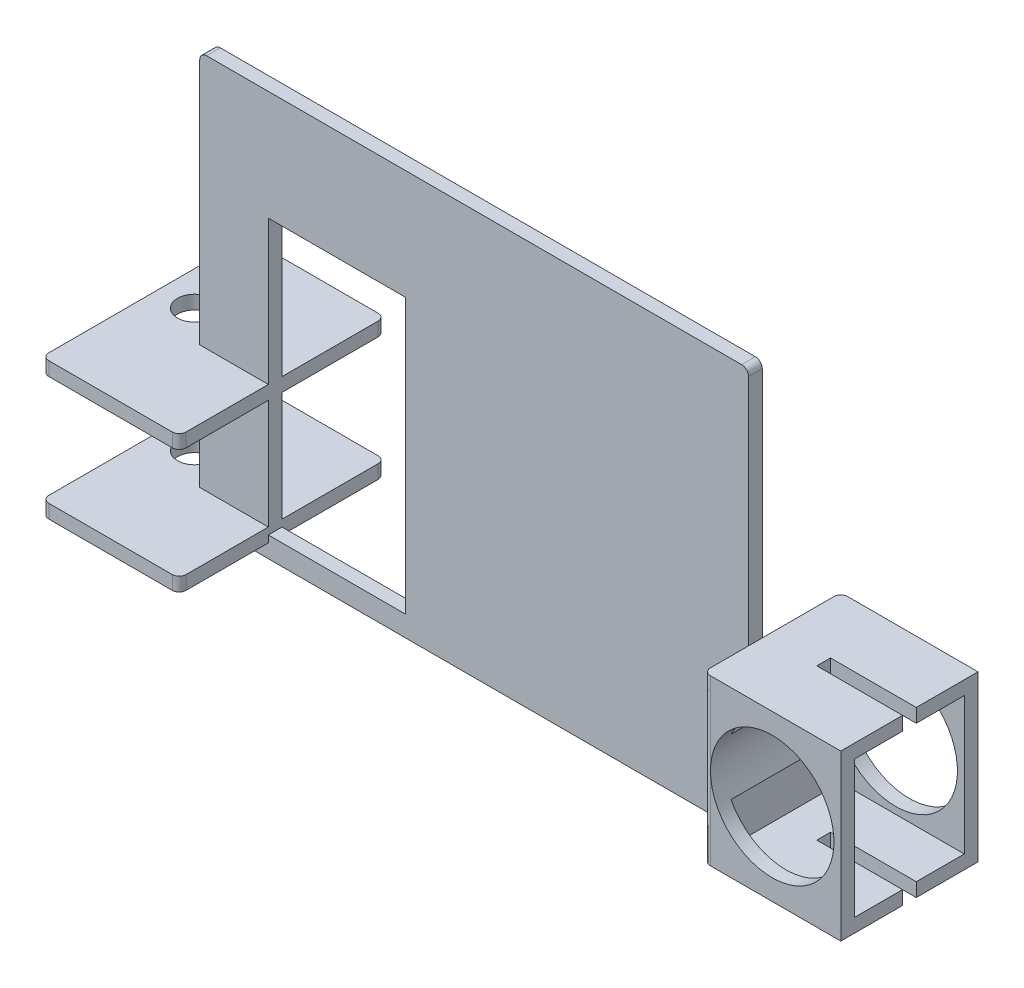
from build123d import *

# Parameters (mm, degrees)
BOSS_EXTRUDE1_DEPTH = 20
FILLET1_R           = 1
SKETCH2_R           = 9
CUT_EXTRUDE1_DEPTH  = 20
BOSS_EXTRUDE2_START = 2
BOSS_EXTRUDE2_DEPTH = 2
SKETCH4_W           = 20
SKETCH4_H           = 20
BOSS_EXTRUDE3_DEPTH = 2
FILLET2_R           = 1
SKETCH5_W           = 12.5
SKETCH5_H           = 2
CUT_EXTRUDE2_DEPTH  = 24
BOSS_EXTRUDE4_DEPTH = 80
FILLET3_R           = 1
SKETCH8_R           = 7.11392485
SKETCH8_W           = 20
SKETCH8_H           = 40
CUT_EXTRUDE3_DEPTH  = 2
SKETCH9_W           = 20
SKETCH9_H           = 2
BOSS_EXTRUDE5_DEPTH = 15
FILLET4_R           = 1
SKETCH10_R          = 2.5
CUT_EXTRUDE4_DEPTH  = 20
CUT_EXTRUDE5_DEPTH  = 1000
SKETCH12_W          = 38.052123651
SKETCH12_H          = 24.689337754
CUT_EXTRUDE6_DEPTH  = 200


with BuildPart() as part:
    # Sketch1 → Boss-Extrude1 (new body)
    with BuildSketch(Plane(origin=(0, 0, 0), x_dir=(1, 0, 0), z_dir=(0, 1, 0))):
        Polygon((-2.291666667, 11.041666667), (-22.291666667, 11.041666667), (-22.291666667, -8.958333333), (-2.291666667, -8.958333333), (-2.291666667, -6.958333333), (-20.291666667, -6.958333333), (-20.291666667, 9.041666667), (-2.291666667, 9.041666667), align=None)
    extrude(amount=BOSS_EXTRUDE1_DEPTH)

    # Fillet1
    fillet1_edges = [part.edges().sort_by_distance(p)[0] for p in [
        (-22.291666667, 10, 8.958333333),
        (-22.291666667, 10, -11.041666667),
    ]]
    fillet(fillet1_edges, radius=FILLET1_R)

    # Sketch2 → Cut-Extrude1 (cut)
    with BuildSketch(Plane.XY.offset(8.958333333)):
        with Locations(Location((-12.291666667, 10, 0), (0, 0, 180))):
            Circle(SKETCH2_R)
    extrude(amount=-CUT_EXTRUDE1_DEPTH, mode=Mode.SUBTRACT)

    # Sketch3 → Boss-Extrude2 (add)
    with BuildSketch(Plane(origin=(0, 20, 0), x_dir=(1, 0, 0), z_dir=(0, 1, 0)).offset(BOSS_EXTRUDE2_START)):
        Polygon((-2.291666667, 2.377848536), (-2.291666667, 9.041666667), (-20.291666667, 9.041666667), (-20.291666667, -6.958333333), (-2.291666667, -6.958333333), (-2.291666667, 0.377848536), align=None)
        with BuildLine():
            Line((-2.291666667, 9.041666667), (-2.291666667, 11.041666667))
            Line((-2.291666667, 11.041666667), (-21.291666667, 11.041666667))
            ThreePointArc((-21.291666667, 11.041666667), (-21.998773448, 10.748773448), (-22.291666667, 10.041666667))
            Line((-22.291666667, 10.041666667), (-22.291666667, -7.958333333))
            ThreePointArc((-22.291666667, -7.958333333), (-21.998773448, -8.665440115), (-21.291666667, -8.958333333))
            Line((-21.291666667, -8.958333333), (-2.291666667, -8.958333333))
            Line((-2.291666667, -8.958333333), (-2.291666667, -6.958333333))
            Line((-2.291666667, -6.958333333), (-20.291666667, -6.958333333))
            Line((-20.291666667, -6.958333333), (-20.291666667, 9.041666667))
            Line((-20.291666667, 9.041666667), (-2.291666667, 9.041666667))
        make_face()
    extrude(amount=-BOSS_EXTRUDE2_DEPTH)

    # Sketch4 → Boss-Extrude3 (add)
    with BuildSketch(Plane.XZ):
        with Locations((-12.291666667, -1.041666667)):
            Rectangle(SKETCH4_W, SKETCH4_H)
    extrude(amount=BOSS_EXTRUDE3_DEPTH)

    # Fillet2
    fillet2_edges = [part.edges().sort_by_distance(p)[0] for p in [
        (-22.291666667, -1, -11.041666667),
        (-22.291666667, -1, 8.958333333),
    ]]
    fillet(fillet2_edges, radius=FILLET2_R - 0.0001)  # a hair under: the kernel refuses the full size

    # Sketch5 → Cut-Extrude2 (cut)
    with BuildSketch(Plane(origin=(0, 22, 0), x_dir=(1, 0, 0), z_dir=(0, 1, 0))):
        with Locations((-8.541666667, 1.041666667)):
            Rectangle(SKETCH5_W, SKETCH5_H)
    extrude(amount=-CUT_EXTRUDE2_DEPTH, mode=Mode.SUBTRACT)

    # Sketch6 → Boss-Extrude4 (add)
    with BuildSketch(Plane.ZY.offset(22.291666667)):
        Polygon((2.408333333, -37), (0.408333333, -37), (0.408333333, -2), (0.408333333, 22), (2.408333333, 22), (2.408333333, -2), align=None)
    extrude(amount=BOSS_EXTRUDE4_DEPTH)

    # Fillet3
    fillet3_edges = [part.edges().sort_by_distance(p)[0] for p in [
        (-22.291666667, -37, 1.408333333),
        (-102.291666667, 22, 1.408333333),
        (-102.291666667, -37, 1.408333333),
    ]]
    fillet(fillet3_edges, radius=FILLET3_R)

    # Sketch8 → Cut-Extrude3 (cut)
    with BuildSketch(Plane(origin=(0, 0, 0.408333333), x_dir=(-1, 0, 0), z_dir=(0, 0, -1))):
        with Locations((12.291666667, 10)):
            Circle(SKETCH8_R)
        with Locations((82.291666667, -1)):
            Rectangle(SKETCH8_W, SKETCH8_H)
    extrude(amount=-CUT_EXTRUDE3_DEPTH, mode=Mode.SUBTRACT)

    # Sketch9 → Boss-Extrude5 (add, symmetric)
    with BuildSketch(Plane(origin=(0, 0, 0.408333333), x_dir=(-1, 0, 0), z_dir=(0, 0, -1))):
        Polygon((92.470978063, 20), (102.291666667, 20), (112.291666667, 20), (112.291666667, 18), (102.291666667, 18), (92.291666667, 18), (92.291666667, 20), align=None)
        with Locations((102.291666667, 1)):
            Rectangle(SKETCH9_W, SKETCH9_H)
    extrude(amount=BOSS_EXTRUDE5_DEPTH, both=True)

    # Fillet4
    fillet4_edges = [part.edges().sort_by_distance(p)[0] for p in [
        (-92.291666667, 19, 15.408333333),
        (-112.291666667, 19, 15.408333333),
        (-92.291666667, 19, -14.591666667),
        (-112.291666667, 19, -14.591666667),
        (-92.291666667, 1, 15.408333333),
        (-112.291666667, 1, 15.408333333),
        (-92.291666667, 1, -14.591666667),
        (-112.291666667, 1, -14.591666667),
    ]]
    fillet(fillet4_edges, radius=FILLET4_R)

    # Sketch10 → Cut-Extrude4 (cut)
    with BuildSketch(Plane.XZ):
        with Locations((-107.291666667, -1.848697286)):
            Circle(SKETCH10_R)
        with Locations((-107.291666667, -9.848697286)):
            Circle(SKETCH10_R)
    extrude(amount=-CUT_EXTRUDE4_DEPTH, mode=Mode.SUBTRACT)

    # Mirror1: part across plane


with BuildPart() as part_1:
    add(part.part)
    add(part.part.mirror(Plane.ZX.offset(22)))

    # Sketch11 → Cut-Extrude5 (cut)
    with BuildSketch(Plane.ZY.offset(102.291666667)):
        Polygon((0.408333333, 22), (17.6685399, 22), (17.6685399, -41.876309172), (-35.169754822, -41.876309172), (-35.169754822, 22), align=None)
    extrude(amount=-CUT_EXTRUDE5_DEPTH, mode=Mode.SUBTRACT)


with BuildPart() as cut_extrude5_piece_1:
    # of the separate pieces the step leaves, piece 1, a body of its own (cut_extrude5_pieces)
    add(part_1.part.solids().sort_by_distance((-101.291666667, 22, 2.408333333))[0])


with BuildPart() as cut_extrude5_piece_2:
    # of the separate pieces the step leaves, piece 2, a body of its own (cut_extrude5_pieces)
    add(part_1.part.solids().sort_by_distance((-102.291666667, 2, -14.591666667))[0])


with BuildPart() as cut_extrude5_piece_3:
    # of the separate pieces the step leaves, piece 3, a body of its own (cut_extrude5_pieces)
    add(part_1.part.solids().sort_by_distance((-111.291666667, 20, 15.408333333))[0])


with BuildPart() as cut_extrude6_tool:
    # Sketch12 → Cut-Extrude6 (new body)
    with BuildSketch(Plane.ZY.offset(112.291666667)):
        with Locations((0.662862589, 8.620210787)):
            Rectangle(SKETCH12_W, SKETCH12_H)
    extrude(amount=-CUT_EXTRUDE6_DEPTH)


with BuildPart() as cut_extrude5_piece_2_1:
    add(cut_extrude5_piece_2.part)

    # Cut-Extrude6: cut by cut_extrude6_tool
    add(cut_extrude6_tool.part, mode=Mode.SUBTRACT)


with BuildPart() as cut_extrude5_piece_3_1:
    add(cut_extrude5_piece_3.part)

    # Cut-Extrude6: cut by cut_extrude6_tool
    add(cut_extrude6_tool.part, mode=Mode.SUBTRACT)


solid = cut_extrude5_piece_1.part
